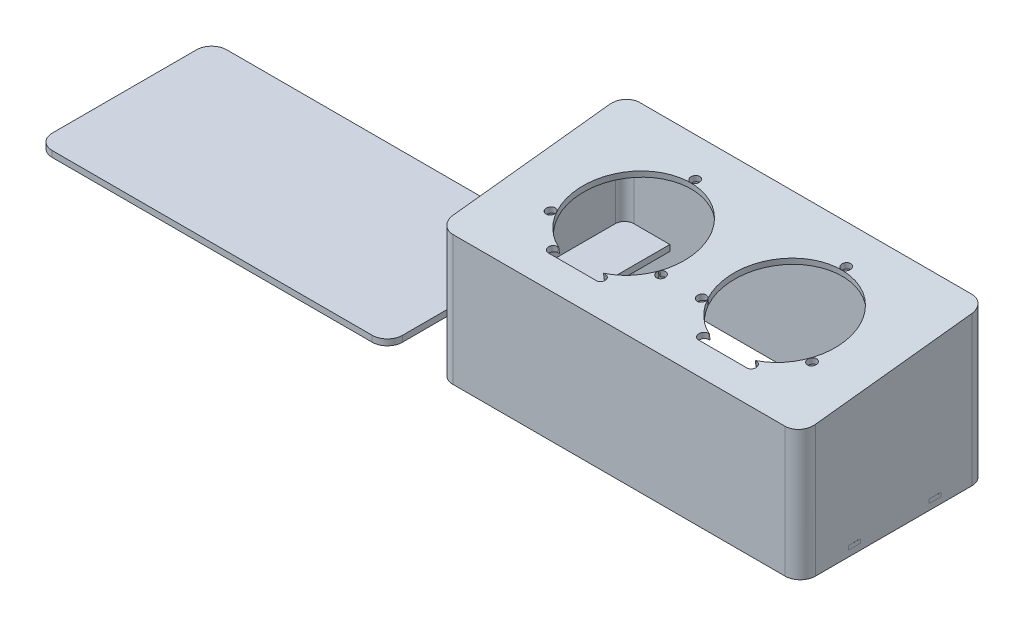
from build123d import *

# Parameters (mm, degrees)
EXTRUDE_6_DEPTH          = 50
CUT_EXTRUDE_1_DEPTH      = 134.718463472
CUT_EXTRUDE_1_DEPTH_BACK = 134.718463472
SKETCH_5_R               = 19
CUT_EXTRUDE_2_DEPTH      = 99.714931123
SHELL_3_T                = -1.917945634
CUT_EXTRUDE_3_DEPTH      = 20
SKETCH_20_R              = 1.5
CUT_EXTRUDE_4_DEPTH      = 20
EXTRUDE_10_DEPTH         = 21
SKETCH_26_W              = 57.96410873
SKETCH_26_H              = 2
EXTRUDE_11_DEPTH         = 15
EXTRUDE_12_DEPTH         = 2
SKETCH_29_W              = 4
SKETCH_29_H              = 1.31013256
EXTRUDE_13_DEPTH         = 2
EXTRUDE_15_DEPTH         = 0.01
EXTRUDE_15_DEPTH_BACK    = 10
SKETCH_34_W              = 4
SKETCH_34_H              = 1.31013256


with BuildPart() as part:
    # 草图3 → 凸台-拉伸6 (new body)
    with BuildSketch(Plane(origin=(0, 0, 0), x_dir=(1, 0, 0), z_dir=(0, 1, 0))):
        with BuildLine():
            Line((-35.258285714, 30.485027968), (74.741714286, 30.485027968))
            ThreePointArc((74.741714286, 30.485027968), (78.277248192, 29.020561874), (79.741714286, 25.485027968))
            Line((79.741714286, 25.485027968), (79.741714286, -26.314972032))
            ThreePointArc((79.741714286, -26.314972032), (78.277248192, -29.850505938), (74.741714286, -31.314972032))
            Line((74.741714286, -31.314972032), (-35.258285714, -31.314972032))
            ThreePointArc((-35.258285714, -31.314972032), (-38.79381962, -29.850505938), (-40.258285714, -26.314972032))
            Line((-40.258285714, -26.314972032), (-40.258285714, 25.485027968))
            ThreePointArc((-40.258285714, 25.485027968), (-38.79381962, 29.020561874), (-35.258285714, 30.485027968))
        make_face()
    extrude(amount=EXTRUDE_6_DEPTH)

    # 草图4 → 切除-拉伸1 (cut, two sides: drawn at the far end of the back side and taken through both)
    with BuildSketch(Plane(origin=(79.741714286, 0, 0), x_dir=(0, 0, -1), z_dir=(1, 0, 0)).offset(-CUT_EXTRUDE_1_DEPTH_BACK)):
        Polygon((30.485027968, 50), (-31.314972032, 43), (-31.314972032, 50), align=None)
    extrude(amount=CUT_EXTRUDE_1_DEPTH + CUT_EXTRUDE_1_DEPTH_BACK, mode=Mode.SUBTRACT)

    # 草图5 → 切除-拉伸2 (cut, through all)
    with BuildSketch(Plane(origin=(0, 45.957380333, 5.205528517), x_dir=(1, 0, 0), z_dir=(0, 0.9936461847514532, 0.11254892060291542))):
        with Locations((44.741714286, 3.723601101)):
            Circle(SKETCH_5_R)
        with Locations((-5.258285714, 3.723601101)):
            Circle(SKETCH_5_R)
    extrude(amount=-CUT_EXTRUDE_2_DEPTH, mode=Mode.SUBTRACT)

    # 抽壳3
    shell_3_openings = [part.faces().sort_by_distance(p)[0] for p in [
        (25.741714286, 22.093486843, -1.244912951),
        (-24.258285714, 22.093486843, -1.244912951),
        (19.741714286, 0, 2.273730845),
    ]]
    offset(amount=SHELL_3_T, openings=shell_3_openings, kind=Kind.INTERSECTION)

    # 草图18 → 切除-拉伸3 (cut)
    with BuildSketch(Plane(origin=(0, 45.957380333, 5.205528517), x_dir=(1, 0, 0), z_dir=(0, 0.9936461847514532, 0.11254892060291542))):
        with BuildLine():
            Line((-13.210731135, -13.776398899), (2.789268865, -13.776398899))
            ThreePointArc((2.789268865, -13.776398899), (4.289268865, -15.276398899), (2.789268865, -16.776398899))
            Line((2.789268865, -16.776398899), (-13.210731135, -16.776398899))
            ThreePointArc((-13.210731135, -16.776398899), (-14.710731135, -15.276398899), (-13.210731135, -13.776398899))
        make_face()
        with BuildLine():
            Line((36.717832971, -13.687262667), (52.717832971, -13.687262667))
            ThreePointArc((52.717832971, -13.687262667), (54.306969203, -15.276398899), (52.717832971, -16.865535131))
            Line((52.717832971, -16.865535131), (36.717832971, -16.865535131))
            ThreePointArc((36.717832971, -16.865535131), (35.12869674, -15.276398899), (36.717832971, -13.687262667))
        make_face()
    extrude(amount=-CUT_EXTRUDE_3_DEPTH, mode=Mode.SUBTRACT)

    # 草图20 → 切除-拉伸4 (cut)
    with BuildSketch(Plane(origin=(0, 45.957380333, 5.205528517), x_dir=(1, 0, 0), z_dir=(0, 0.9936461847514532, 0.11254892060291542))):
        with Locations((-5.261677013, 24.235619392)):
            Circle(SKETCH_20_R)
        with Locations((-23.561325187, -5.556284802)):
            Circle(SKETCH_20_R)
        with Locations((63.044753758, -5.556284802)):
            Circle(SKETCH_20_R)
        with Locations((13.019403007, -5.539226331)):
            Circle(SKETCH_20_R)
        with Locations((26.464025565, -5.539226331)):
            Circle(SKETCH_20_R)
        with Locations((44.745105584, 24.235619392)):
            Circle(SKETCH_20_R)
    extrude(amount=-CUT_EXTRUDE_4_DEPTH, mode=Mode.SUBTRACT)

    # 草图15 → 凸台-拉伸10 (add)
    with BuildSketch(Plane.ZY.offset(-77.823768652)):
        Polygon((0, 20), (-28.567082334, 20), (-28.567082334, 18), (0, 18), (29.397026398, 18), (29.397026398, 20), align=None)
    extrude(amount=EXTRUDE_10_DEPTH)

    # 草图26 → 凸台-拉伸11 (add)
    with BuildSketch(Plane(origin=(-38.34034008, 0, 0), x_dir=(0, 0, -1), z_dir=(1, 0, 0))):
        with Locations((-0.085016521, 15.175920517)):
            Rectangle(SKETCH_26_W, SKETCH_26_H)
    extrude(amount=EXTRUDE_11_DEPTH)

    # 草图29 → 凸台-拉伸13 (add)
    with BuildSketch(Plane(origin=(-38.34034008, 0, 0), x_dir=(0, 0, -1), z_dir=(1, 0, 0))):
        with Locations((-12.483786097, 2.65506628)):
            Rectangle(SKETCH_29_W, SKETCH_29_H)
        with Locations((12.483786097, 2.65506628)):
            Rectangle(SKETCH_29_W, SKETCH_29_H)
    extrude(amount=EXTRUDE_13_DEPTH)

    # 草图34 → 凸台-拉伸15 (add, two sides: drawn at the far end of the back side and taken through both)
    with BuildSketch(Plane(origin=(79.741714286, 0, 0), x_dir=(0, 0, -1), z_dir=(1, 0, 0)).offset(-EXTRUDE_15_DEPTH_BACK)):
        with Locations((-13.323022069, 2.65506628)):
            Rectangle(SKETCH_34_W, SKETCH_34_H)
        with Locations((13.323022069, 2.65506628)):
            Rectangle(SKETCH_34_W, SKETCH_34_H)
    extrude(amount=EXTRUDE_15_DEPTH + EXTRUDE_15_DEPTH_BACK)


with BuildPart() as body_2:
    # 草图7 → 凸台-拉伸12 (new body)
    with BuildSketch(Plane(origin=(0, 0, 0), x_dir=(-1, 0, 0), z_dir=(0, -1, 0))):
        with BuildLine():
            Line((168.752385543, -30.594833488), (62.752385543, -30.594833488))
            ThreePointArc((62.752385543, -30.594833488), (59.216851637, -29.130367394), (57.752385543, -25.594833488))
            Line((57.752385543, -25.594833488), (57.752385543, 22.205166512))
            ThreePointArc((57.752385543, 22.205166512), (59.216851637, 25.740700418), (62.752385543, 27.205166512))
            Line((62.752385543, 27.205166512), (168.752385543, 27.205166512))
            ThreePointArc((168.752385543, 27.205166512), (172.287919449, 25.740700418), (173.752385543, 22.205166512))
            Line((173.752385543, 22.205166512), (173.752385543, -25.594833488))
            ThreePointArc((173.752385543, -25.594833488), (172.287919449, -29.130367394), (168.752385543, -30.594833488))
        make_face()
    extrude(amount=EXTRUDE_12_DEPTH)


solid = Compound([part.part, body_2.part])
